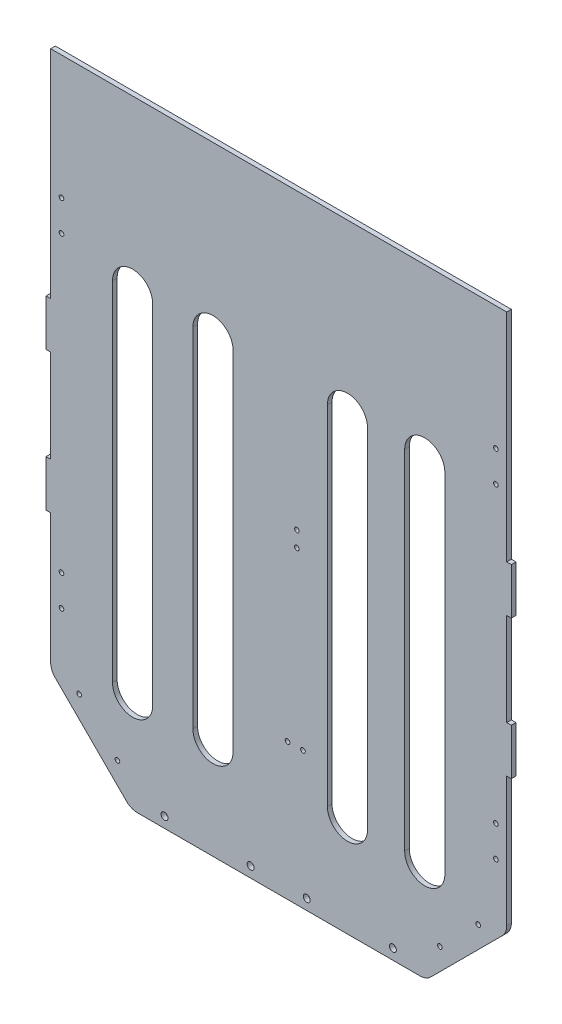
from build123d import *

# Parameters (mm, degrees)
EXTRUDE_1_DEPTH     = 3
CUT_EXTRUDE_2_DEPTH = 228.06662018
SKETCH_2_R          = 1.5
SKETCH_2_R_2        = 2.25
CUT_EXTRUDE_1_DEPTH = 10
SKETCH_4_R          = 1.5
CUT_EXTRUDE_3_DEPTH = 228.06662018
CUT_EXTRUDE_4_DEPTH = 228.06662018
FILLET_3_R          = 10
SKETCH_8_R          = 1.5
CUT_EXTRUDE_5_DEPTH = 228.06662018
SKETCH_9_W          = 295
SKETCH_9_H          = 60
EXTRUDE_2_DEPTH     = 3
SKETCH_10_R         = 1.5
CUT_EXTRUDE_6_DEPTH = 10


with BuildPart() as part:
    # 草图1 → 凸台-拉伸1 (new body)
    with BuildSketch(Plane.XY):
        Polygon((-147.5, 90), (-150.5, 90), (-150.5, 60), (-147.5, 60), (-147.5, 0), (-150.5, 0), (-150.5, -30), (-147.5, -30), (-147.5, -90), (-147.5, -120), (-147.5, -170), (147.5, -170), (147.5, -120), (147.5, -90), (147.5, -30), (150.5, -30), (150.5, 0), (147.5, 0), (147.5, 60), (150.5, 60), (150.5, 90), (147.5, 90), (147.5, 170), (-147.5, 170), align=None)
    extrude(amount=EXTRUDE_1_DEPTH)

    # 草图3 → 切除-拉伸2 (cut, through all)
    with BuildSketch(Plane.XY.offset(3)):
        Polygon((-147.5, -118), (-95.5, -170), (-147.5, -170), align=None)
        Polygon((147.5, -170), (147.5, -118), (95.5, -170), align=None)
    extrude(amount=-CUT_EXTRUDE_2_DEPTH, mode=Mode.SUBTRACT)

    # 草图2 → 切除-拉伸1 (cut)
    with BuildSketch(Plane.XY.offset(3)):
        with Locations((11.800454572, 40)):
            Circle(SKETCH_2_R)
        with Locations((11.800454572, 30)):
            Circle(SKETCH_2_R)
        with Locations((-73.85, -163.15)):
            Circle(SKETCH_2_R_2)
        with Locations((-18.15, -163.15)):
            Circle(SKETCH_2_R_2)
        with Locations((18.15, -163.15)):
            Circle(SKETCH_2_R_2)
        with Locations((73.85, -163.15)):
            Circle(SKETCH_2_R_2)
    extrude(amount=-CUT_EXTRUDE_1_DEPTH, mode=Mode.SUBTRACT)

    # 草图4 → 切除-拉伸3 (cut, through all)
    with BuildSketch(Plane.XY.offset(3)):
        with Locations((140.5, 150)):
            Circle(SKETCH_4_R)
        with Locations((140.5, 130)):
            Circle(SKETCH_4_R)
        with Locations((140.5, -60)):
            Circle(SKETCH_4_R)
        with Locations((140.5, -80)):
            Circle(SKETCH_4_R)
        with Locations((-140.5, -80)):
            Circle(SKETCH_4_R)
        with Locations((-140.5, -60)):
            Circle(SKETCH_4_R)
        with Locations((-140.5, 130)):
            Circle(SKETCH_4_R)
        with Locations((-140.5, 150)):
            Circle(SKETCH_4_R)
    extrude(amount=-CUT_EXTRUDE_3_DEPTH, mode=Mode.SUBTRACT)

    # 草图5 → 切除-拉伸4 (cut, through all)
    with BuildSketch(Plane.XY.offset(3)):
        with BuildLine():
            Line((-81.5, 120), (-81.5, -105))
            ThreePointArc((-81.5, -105), (-94.5, -118), (-107.5, -105))
            Line((-107.5, -105), (-107.5, 120))
            ThreePointArc((-107.5, 120), (-94.5, 133), (-81.5, 120))
        make_face()
        with BuildLine():
            Line((-29.5, 120), (-29.5, -105))
            ThreePointArc((-29.5, -105), (-42.5, -118), (-55.5, -105))
            Line((-55.5, -105), (-55.5, 120))
            ThreePointArc((-55.5, 120), (-42.5, 133), (-29.5, 120))
        make_face()
        with BuildLine():
            Line((57.5, 120), (57.5, -105))
            ThreePointArc((57.5, -105), (44.5, -118), (31.5, -105))
            Line((31.5, -105), (31.5, 120))
            ThreePointArc((31.5, 120), (44.5, 133), (57.5, 120))
        make_face()
        with BuildLine():
            Line((107.5, 120), (107.5, -105))
            ThreePointArc((107.5, -105), (94.5, -118), (81.5, -105))
            Line((81.5, -105), (81.5, 120))
            ThreePointArc((81.5, 120), (94.5, 133), (107.5, 120))
        make_face()
    extrude(amount=-CUT_EXTRUDE_4_DEPTH, mode=Mode.SUBTRACT)

    # 圆角3
    fillet_3_edges = [part.edges().sort_by_distance(p)[0] for p in [
        (147.5, -118, 1.5),
        (95.5, -170, 1.5),
        (-95.5, -170, 1.5),
        (-147.5, -118, 1.5),
    ]]
    fillet(fillet_3_edges, radius=FILLET_3_R)

    # 草图8 → 切除-拉伸5 (cut, through all)
    with BuildSketch(Plane.XY.offset(3)):
        with Locations((-129.044105664, -122.313758713)):
            Circle(SKETCH_8_R)
        with Locations((-104.295368322, -147.062496054)):
            Circle(SKETCH_8_R)
        with Locations((104.295368322, -147.062496054)):
            Circle(SKETCH_8_R)
        with Locations((129.044105664, -122.313758713)):
            Circle(SKETCH_8_R)
    extrude(amount=-CUT_EXTRUDE_5_DEPTH, mode=Mode.SUBTRACT)

    # 草图9 → 凸台-拉伸2 (add)
    with BuildSketch(Plane.XY.offset(3)):
        with Locations((0, 200)):
            Rectangle(SKETCH_9_W, SKETCH_9_H)
    extrude(amount=-EXTRUDE_2_DEPTH)

    # 草图10 → 切除-拉伸6 (cut)
    with BuildSketch(Plane(origin=(0, 0, 0), x_dir=(-1, 0, 0), z_dir=(0, 0, -1))):
        with Locations((-15.714480525, -81.497694715)):
            Circle(SKETCH_10_R)
        with Locations((-5.714480525, -81.497694715)):
            Circle(SKETCH_10_R)
    extrude(amount=-CUT_EXTRUDE_6_DEPTH, mode=Mode.SUBTRACT)


solid = part.part
